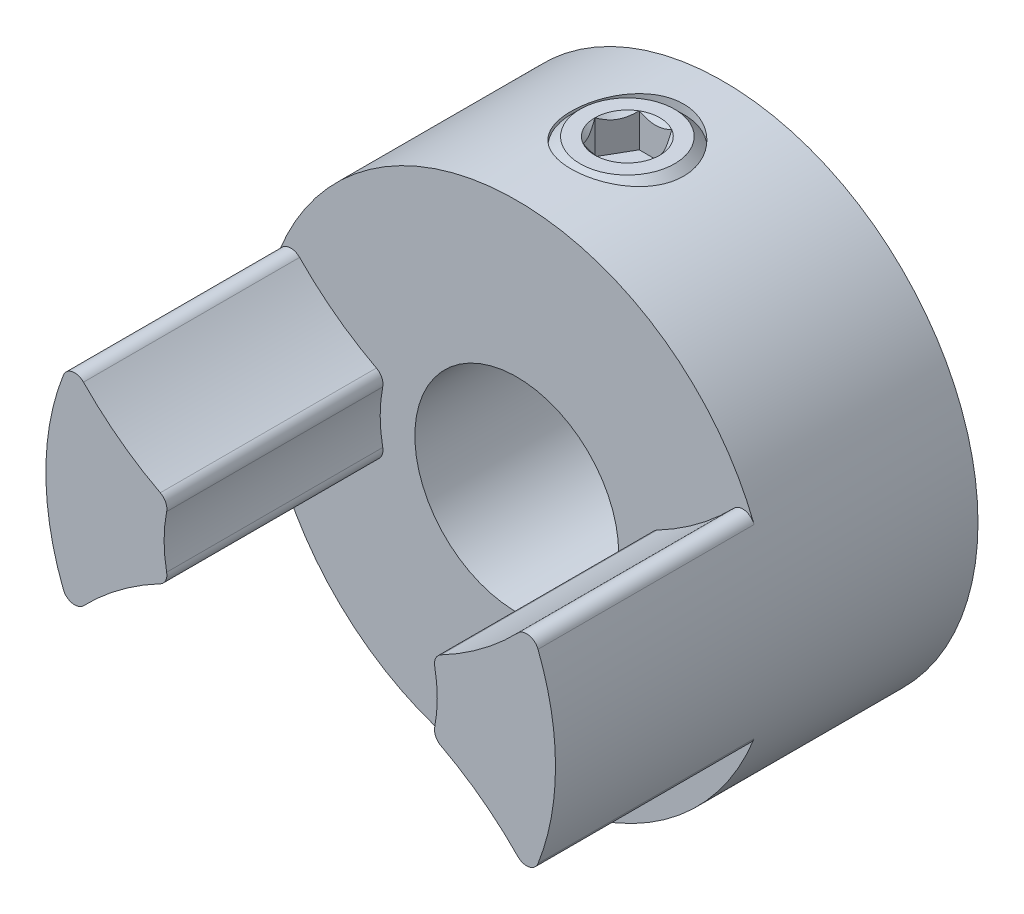
from build123d import *
from OCP.BRepFilletAPI import BRepFilletAPI_MakeChamfer
from build123d.topology import SkipClean

# Parameters (mm, degrees)
BOSS_EXTRUDE1_START     = -3.571875
SKETCH1_R               = 7.9375
BOSS_EXTRUDE1_DEPTH     = 6.746875
BOSS_EXTRUDE4_START     = 6.731
BOSS_EXTRUDE4_DEPTH     = 6.731
FILLET2_R               = 0.381
MOVE_START              = -3.571875
MOVE_FACE3_DEPTH        = 6.731
MOVE_FACE3_2_DEPTH      = 6.731
CIRPATTERN2_START       = -3.571875
CIRPATTERN2_DEPTH       = 6.731
CUT_EXTRUDE5_DEPTH      = 16.24743959
CUT_EXTRUDE5_DEPTH_BACK = 16.24743959
SKETCH15_R              = 3.175
CHAMFER1_SIZE           = 0.3175
CHAMFER1_SIZE2          = 0.470713108
SKETCH5_R               = 1.7526
CUT_EXTRUDE2_DEPTH      = 16.24743959
SKETCH6_R               = 1.7526
BOSS_EXTRUDE3_DEPTH     = 4.7625
CUT_EXTRUDE3_DEPTH      = 1.05156
CHAMFER3_SIZE           = 0.280416
CHAMFER4_SIZE           = 0.595884


# Read off the part's stored shape, not the designer's step: Move Face3, CirPattern2
with BuildPart() as part:
    # Sketch1 → Boss-Extrude1 (new body)
    with BuildSketch(Plane.XY.offset(BOSS_EXTRUDE1_START)):
        Circle(SKETCH1_R)
    extrude(amount=-BOSS_EXTRUDE1_DEPTH)

    # Sketch10 → Boss-Extrude4 (add)
    with BuildSketch(Plane.XY.offset(-3.571875).offset(BOSS_EXTRUDE4_START)):
        with BuildLine():
            ThreePointArc((-1.096318236, -4.110821886), (0, -4.2545), (1.096318236, -4.110821886))
            ThreePointArc((1.096318236, -4.110821886), (2.111997853, -5.752575517), (3.440933621, -7.152893266))
            ThreePointArc((3.440933621, -7.152893266), (0, -7.9375), (-3.440933621, -7.152893266))
            ThreePointArc((-3.440933621, -7.152893266), (-2.111997853, -5.752575517), (-1.096318236, -4.110821886))
        make_face()
    extrude(amount=-BOSS_EXTRUDE4_DEPTH)

    # Fillet2
    fillet2_edges = [part.edges().sort_by_distance(p)[0] for p in [
        (-3.440933621, -7.152893266, -0.206375),
        (3.440933621, -7.152893266, -0.206375),
        (-1.096318236, -4.110821886, -0.206375),
        (1.096318236, -4.110821886, -0.206375),
    ]]
    fillet(fillet2_edges, radius=FILLET2_R)

    # Move Face3 outline → Move Face3 (cut)
    with BuildSketch(Plane.XY.offset(MOVE_START)):
        with BuildLine():
            ThreePointArc((-3.015425868, -6.764758592), (-3.123679186, -7.113503156), (-2.888846251, -7.393136925))
            ThreePointArc((-2.888846251, -7.393136925), (0, -7.9375), (2.888846251, -7.393136925))
            ThreePointArc((2.888846251, -7.393136925), (3.123679186, -7.113503156), (3.015425868, -6.764758592))
            ThreePointArc((3.015425868, -6.764758592), (2.026423119, -5.639802857), (1.228164561, -4.372350642))
            ThreePointArc((1.228164561, -4.372350642), (1.055516359, -4.205643666), (0.817454229, -4.175229195))
            ThreePointArc((0.817454229, -4.175229195), (0, -4.2545), (-0.817454229, -4.175229195))
            ThreePointArc((-0.817454229, -4.175229195), (-1.055516359, -4.205643666), (-1.228164561, -4.372350642))
            ThreePointArc((-1.228164561, -4.372350642), (-2.026423119, -5.639802857), (-3.015425868, -6.764758592))
        make_face()
    extrude(amount=MOVE_FACE3_DEPTH, mode=Mode.SUBTRACT)

    # Move Face3 2 outline → Move Face3 2 (add)
    with SkipClean():  # the faces are left unmerged after this step: merging them gives an invalid solid
        with BuildSketch(Plane.XY.offset(MOVE_START)):
            with BuildLine():
                ThreePointArc((7.393136925, 2.888846251), (7.113503156, 3.123679186), (6.764758592, 3.015425868))
                ThreePointArc((6.764758592, 3.015425868), (5.639802857, 2.026423119), (4.372350642, 1.228164561))
                ThreePointArc((4.372350642, 1.228164561), (4.205643666, 1.055516359), (4.175229195, 0.817454229))
                ThreePointArc((4.175229195, 0.817454229), (4.2545, 0), (4.175229195, -0.817454229))
                ThreePointArc((4.175229195, -0.817454229), (4.205643666, -1.055516359), (4.372350642, -1.228164561))
                ThreePointArc((4.372350642, -1.228164561), (5.639802857, -2.026423119), (6.764758592, -3.015425868))
                ThreePointArc((6.764758592, -3.015425868), (7.113503156, -3.123679186), (7.393136925, -2.888846251))
                ThreePointArc((7.393136925, -2.888846251), (7.9375, 0), (7.393136925, 2.888846251))
            make_face()
        extrude(amount=MOVE_FACE3_2_DEPTH)

    # CirPattern2 outline → CirPattern2 (add)
    with SkipClean():  # the faces are left unmerged after this step: merging them gives an invalid solid
        with BuildSketch(Plane.XY.offset(CIRPATTERN2_START)):
            with BuildLine():
                ThreePointArc((-4.372350642, 1.228164561), (-5.639802857, 2.026423119), (-6.764758592, 3.015425868))
                ThreePointArc((-6.764758592, 3.015425868), (-7.113503156, 3.123679186), (-7.393136925, 2.888846251))
                ThreePointArc((-7.393136925, 2.888846251), (-7.9375, 0), (-7.393136925, -2.888846251))
                ThreePointArc((-7.393136925, -2.888846251), (-7.113503156, -3.123679186), (-6.764758592, -3.015425868))
                ThreePointArc((-6.764758592, -3.015425868), (-5.639802857, -2.026423119), (-4.372350642, -1.228164561))
                ThreePointArc((-4.372350642, -1.228164561), (-4.205643666, -1.055516359), (-4.175229195, -0.817454229))
                ThreePointArc((-4.175229195, -0.817454229), (-4.2545, 0), (-4.175229195, 0.817454229))
                ThreePointArc((-4.175229195, 0.817454229), (-4.205643666, 1.055516359), (-4.372350642, 1.228164561))
            make_face()
        extrude(amount=CIRPATTERN2_DEPTH)

    # Sketch15 → Cut-Extrude5 (cut, two sides: drawn at the far end of the back side and taken through both)
    with SkipClean():  # the faces are left unmerged after this step: merging them gives an invalid solid
        with BuildSketch(Plane.XY.offset(-CUT_EXTRUDE5_DEPTH_BACK)):
            Circle(SKETCH15_R)
        extrude(amount=CUT_EXTRUDE5_DEPTH + CUT_EXTRUDE5_DEPTH_BACK, mode=Mode.SUBTRACT)

    # Chamfer1: one chamfer whose edges measure the first distance from different faces: ONE call of the kernel's chamfer builder (chamfer() names one face for all edges)
    chamfer1_edges_1 = [part.edges().sort_by_distance(p)[0] for p in [
        (-7.9375, 0, -10.31875),
    ]]
    chamfer1_side_1 = [part.faces().sort_by_distance(p)[0] for p in [
        (-7.9375, 0, -6.9453125),
    ]]
    chamfer1_edges_2 = [part.edges().sort_by_distance(p)[0] for p in [
        (-3.175, 0, -10.31875),
    ]]
    chamfer1_side_2 = [part.faces().sort_by_distance(p)[0] for p in [
        (-3.175, 0, -6.9453125),
    ]]
    chamfer1 = BRepFilletAPI_MakeChamfer(part.part.solid().wrapped)
    for e in chamfer1_edges_1:
        chamfer1.Add(CHAMFER1_SIZE, CHAMFER1_SIZE2, e.wrapped, chamfer1_side_1[0].wrapped)  # the first distance lies on this face
    for e in chamfer1_edges_2:
        chamfer1.Add(CHAMFER1_SIZE, CHAMFER1_SIZE2, e.wrapped, chamfer1_side_2[0].wrapped)  # the first distance lies on this face
    add(Compound.cast(chamfer1.Shape()), mode=Mode.REPLACE)

    # Sketch5 → Cut-Extrude2 (cut, through all)
    with SkipClean():  # the faces are left unmerged after this step: merging them gives an invalid solid
        with BuildSketch(Plane(origin=(0, 0, 0), x_dir=(1, 0, 0), z_dir=(0, 1, 0))):
            with Locations(Location((0, 7.01675, 0), (0, 0, 90))):
                Circle(SKETCH5_R)
        extrude(amount=CUT_EXTRUDE2_DEPTH, mode=Mode.SUBTRACT)


with BuildPart() as body_2:
    # Sketch6 → Boss-Extrude3 (new body)
    with BuildSketch(Plane(origin=(0, 7.9375, 0), x_dir=(-1, 0, 0), z_dir=(0, 1, 0))):
        with Locations(Location((0, -7.01675, 0), (0, 0, 90))):
            Circle(SKETCH6_R)
    extrude(amount=-BOSS_EXTRUDE3_DEPTH)

    # Sketch8 → Cut-Extrude3 (cut)
    with BuildSketch(Plane(origin=(0, 7.9375, 0), x_dir=(1, 0, 0), z_dir=(0, 1, 0))):
        Polygon((0.505932041, 6.14045), (1.011864082, 7.01675), (0.505932041, 7.89305), (-0.505932041, 7.89305), (-1.011864082, 7.01675), (-0.505932041, 6.14045), align=None)
    extrude(amount=-CUT_EXTRUDE3_DEPTH, mode=Mode.SUBTRACT)

    # Cut-Extrude4 cone 1 section (through the dimple's axis) → Cut-Extrude4 (revolve, cut)
    with BuildSketch(Plane(origin=(0, 7.9375, -7.01675), x_dir=(0, 0, 1), z_dir=(1, 0, 0))):
        Polygon((0, 0), (1.011864082, 0), (0, 1.011864082), align=None)
    revolve(axis=Axis((0, 7.9375, -7.01675), (0, -1, 0)), mode=Mode.SUBTRACT)

    # Chamfer3
    chamfer3_edges = [body_2.edges().sort_by_distance(p)[0] for p in [
        (0, 7.9375, -8.76935),
    ]]
    chamfer(chamfer3_edges, length=CHAMFER3_SIZE)

    # Chamfer4
    chamfer4_edges = [body_2.edges().sort_by_distance(p)[0] for p in [
        (0, 3.175, -8.76935),
    ]]
    chamfer(chamfer4_edges, length=CHAMFER4_SIZE)


solid = Compound([part.part, body_2.part])
